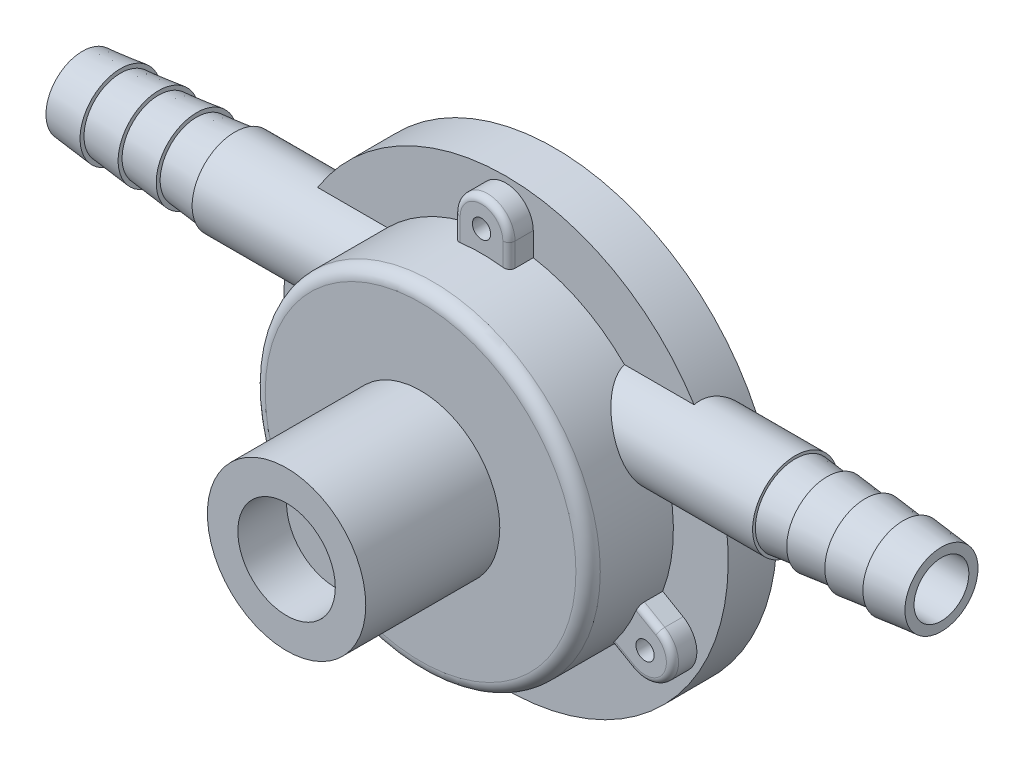
from build123d import *

# Parameters (mm, degrees)
SKETCH1_R                = 36.5
BOSS_EXTRUDE1_DEPTH      = 8
SKETCH2_R                = 27.5
BOSS_EXTRUDE2_DEPTH      = 14
SKETCH3_R                = 13
BOSS_EXTRUDE3_DEPTH      = 22
SKETCH4_R                = 8
CUT_EXTRUDE1_DEPTH       = 8
BOSS_EXTRUDE4_DEPTH      = 10
BOSS_EXTRUDE4_DEPTH_BACK = 82
SKETCH6_R                = 7
CUT_EXTRUDE2_DEPTH       = 12
SKETCH11_R               = 1.5
CUT_EXTRUDE4_DEPTH       = 74.6919264
FILLET1_R                = 2
SKETCH10_R               = 4.5
CUT_EXTRUDE5_DEPTH       = 109.315511473
SKETCH12_R               = 3.2
CUT_EXTRUDE6_DEPTH       = 70.213438174
SKETCH13_R               = 27.3
SKETCH13_R_2             = 25
CUT_EXTRUDE7_DEPTH       = 1.2
BOSS_EXTRUDE5_DEPTH      = 4
FILLET2_R                = 1
SKETCH15_R               = 1.5
CUT_EXTRUDE8_DEPTH       = 74.6919264
SKETCH17_R               = 4.5
CUT_EXTRUDE9_DEPTH       = 153.148775898


with BuildPart() as part:
    # Sketch1 → Boss-Extrude1 (new body)
    with BuildSketch(Plane.XY):
        Circle(SKETCH1_R)
    extrude(amount=BOSS_EXTRUDE1_DEPTH)

    # Sketch2 → Boss-Extrude2 (add)
    with BuildSketch(Plane.XY.offset(8)):
        Circle(SKETCH2_R)
    extrude(amount=BOSS_EXTRUDE2_DEPTH)

    # Sketch3 → Boss-Extrude3 (add)
    with BuildSketch(Plane.XY.offset(22)):
        Circle(SKETCH3_R)
    extrude(amount=BOSS_EXTRUDE3_DEPTH)

    # Sketch4 → Cut-Extrude1 (cut)
    with BuildSketch(Plane.XY.offset(44)):
        Circle(SKETCH4_R)
    extrude(amount=-CUT_EXTRUDE1_DEPTH, mode=Mode.SUBTRACT)

    # Sketch6 → Boss-Extrude4 (add, two sides: drawn at the far end of the back side and taken through both)
    with BuildSketch(Plane(origin=(36.5, 0, 0), x_dir=(0, 0, -1), z_dir=(1, 0, 0)).offset(-BOSS_EXTRUDE4_DEPTH_BACK)):
        with Locations((-7, 12.5)):
            Circle(SKETCH6_R)
    extrude(amount=BOSS_EXTRUDE4_DEPTH + BOSS_EXTRUDE4_DEPTH_BACK)

    # Sketch8 → Cut-Extrude2 (cut)
    with BuildSketch(Plane(origin=(0, 0, 0), x_dir=(-1, 0, 0), z_dir=(0, 0, -1))):
        with BuildLine():
            ThreePointArc((-17.653540721, 13.95), (0, -22.5), (17.653540721, 13.95))
            ThreePointArc((17.653540721, 13.95), (0, 18), (-17.653540721, 13.95))
        make_face()
    extrude(amount=-CUT_EXTRUDE2_DEPTH, mode=Mode.SUBTRACT)

    # Sketch11 → Cut-Extrude4 (cut, through all)
    with BuildSketch(Plane(origin=(0, 0, 0), x_dir=(-1, 0, 0), z_dir=(0, 0, -1))):
        with Locations((0, 31)):
            Circle(SKETCH11_R)
        with Locations((26.846787517, -15.5)):
            Circle(SKETCH11_R)
        with Locations((-26.846787517, -15.5)):
            Circle(SKETCH11_R)
    extrude(amount=-CUT_EXTRUDE4_DEPTH, mode=Mode.SUBTRACT)

    # Fillet1
    fillet1_edges = [part.edges().sort_by_distance(p)[0] for p in [
        (-27.5, 0, 22),
    ]]
    fillet(fillet1_edges, radius=FILLET1_R)

    # Sketch10 → Cut-Extrude5 (cut, through all)
    with BuildSketch(Plane(origin=(46.5, 0, 0), x_dir=(0, 0, -1), z_dir=(1, 0, 0))):
        with Locations((-7, 12.5)):
            Circle(SKETCH10_R)
    extrude(amount=-CUT_EXTRUDE5_DEPTH, mode=Mode.SUBTRACT)

    # Sketch12 → Cut-Extrude6 (cut, through all)
    with BuildSketch(Plane.XY.offset(36)):
        Circle(SKETCH12_R)
    extrude(amount=-CUT_EXTRUDE6_DEPTH, mode=Mode.SUBTRACT)

    # Sketch13 → Cut-Extrude7 (cut)
    with BuildSketch(Plane(origin=(0, 0, 0), x_dir=(-1, 0, 0), z_dir=(0, 0, -1))):
        Circle(SKETCH13_R)
        Circle(SKETCH13_R_2, mode=Mode.SUBTRACT)
    extrude(amount=-CUT_EXTRUDE7_DEPTH, mode=Mode.SUBTRACT)

    # Sketch14 → Boss-Extrude5 (add)
    with BuildSketch(Plane.XY.offset(8)):
        with BuildLine():
            Line((4.5, 31), (4.5, 27.129319933))
            ThreePointArc((4.5, 27.129319933), (0, 27.5), (-4.5, 27.129319933))
            Line((-4.5, 27.129319933), (-4.5, 31))
            ThreePointArc((-4.5, 31), (0, 35.5), (4.5, 31))
        make_face()
        with BuildLine():
            Line((29.096787517, -11.602885683), (25.744680249, -9.667545649))
            ThreePointArc((25.744680249, -9.667545649), (23.815698604, -13.75), (21.244680249, -17.461774283))
            Line((21.244680249, -17.461774283), (24.596787517, -19.397114317))
            ThreePointArc((24.596787517, -19.397114317), (30.743901834, -17.75), (29.096787517, -11.602885683))
        make_face()
        with BuildLine():
            Line((-24.596787517, -19.397114317), (-21.244680249, -17.461774283))
            ThreePointArc((-21.244680249, -17.461774283), (-23.815698604, -13.75), (-25.744680249, -9.667545649))
            Line((-25.744680249, -9.667545649), (-29.096787517, -11.602885683))
            ThreePointArc((-29.096787517, -11.602885683), (-30.743901834, -17.75), (-24.596787517, -19.397114317))
        make_face()
    extrude(amount=BOSS_EXTRUDE5_DEPTH)

    # Fillet2
    fillet2_edges = [part.edges().sort_by_distance(p)[0] for p in [
        (4.5, 29.064659966, 12),
        (-4.5, 29.064659966, 12),
        (22.920733883, -18.4294443, 12),
        (27.420733883, -10.635215666, 12),
        (-27.420733883, -10.635215666, 12),
        (-22.920733883, -18.4294443, 12),
        (0, 35.5, 12),
        (30.743901834, -17.75, 12),
        (-30.743901834, -17.75, 12),
    ]]
    fillet(fillet2_edges, radius=FILLET2_R)

    # Sketch15 → Cut-Extrude8 (cut, through all)
    with BuildSketch(Plane(origin=(0, 0, 0), x_dir=(-1, 0, 0), z_dir=(0, 0, -1))):
        with Locations((0, 31)):
            Circle(SKETCH15_R)
        with Locations((26.846787517, -15.5)):
            Circle(SKETCH15_R)
        with Locations((-26.846787517, -15.5)):
            Circle(SKETCH15_R)
    extrude(amount=-CUT_EXTRUDE8_DEPTH, mode=Mode.SUBTRACT)

    # Sketch16 → Revolve1 (revolve)
    with BuildSketch(Plane(origin=(0, 12.5, 0), x_dir=(1, 0, 0), z_dir=(0, 1, 0))):
        Polygon((-70.5, -13), (-64.25, -13.65), (-64.25, -13), (-58, -13.65), (-58, -13), (-51.75, -13.65), (-51.75, -13), (-45.5, -13.65), (-45.5, -7), (-70.5, -7), align=None)
        Polygon((64.25, -13.65), (70.5, -13), (70.5, -7), (45.5, -7), (45.5, -13.65), (51.75, -13), (51.75, -13.65), (58, -13), (58, -13.65), (64.25, -13), align=None)
    revolve(axis=Axis((70.5, 12.5, 7), (-1, 0, 0)))

    # Sketch17 → Cut-Extrude9 (cut, through all)
    with BuildSketch(Plane(origin=(70.5, 0, 0), x_dir=(0, 0, -1), z_dir=(1, 0, 0))):
        with Locations((-7, 12.5)):
            Circle(SKETCH17_R)
    extrude(amount=-CUT_EXTRUDE9_DEPTH, mode=Mode.SUBTRACT)


solid = part.part
